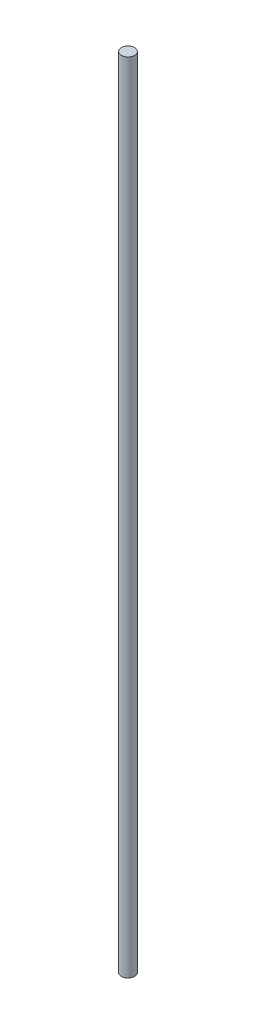
from build123d import *

# Parameters (mm, degrees)
SKETCH1_R           = 1.016
BOSS_EXTRUDE1_DEPTH = 120.65


with BuildPart() as part:
    # Sketch1 → Boss-Extrude1 (new body)
    with BuildSketch(Plane(origin=(0, 0, 0), x_dir=(1, 0, 0), z_dir=(0, 1, 0))):
        Circle(SKETCH1_R)
    extrude(amount=BOSS_EXTRUDE1_DEPTH)


solid = part.part
